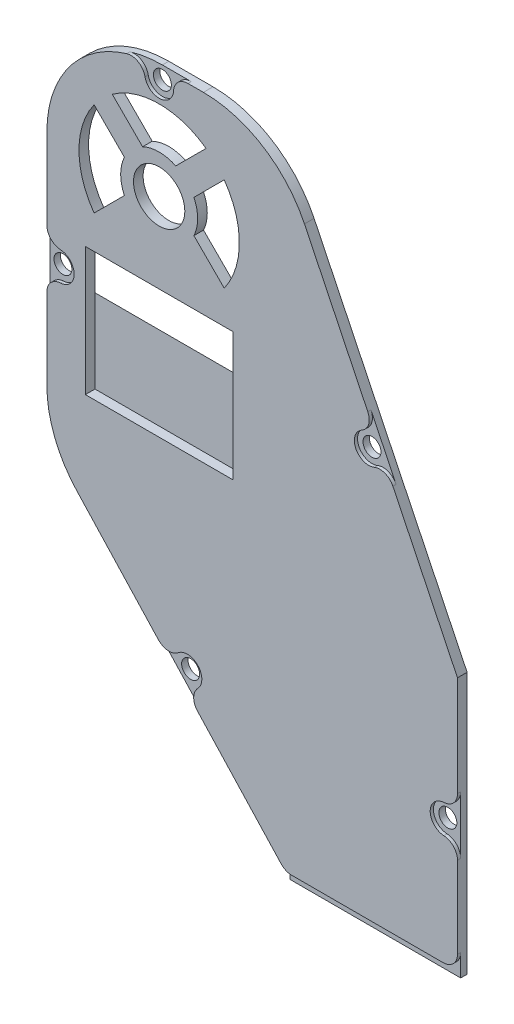
from build123d import *

# Parameters (mm, degrees)
EXTRUDE_1_DEPTH     = 1
EXTRUDE_2_DEPTH     = 0.5
FILLET_1_R          = 2.25
CUT_EXTRUDE_1_REACH = 96.714
SKETCH_3_R          = 1.4
CUT_EXTRUDE_2_REACH = 96.714
SKETCH_4_R          = 4
SKETCH_4_W          = 23
SKETCH_4_H          = 20
EXTRUDE_START       = 1.5
EXTRUDE_3_DEPTH     = 1.5
FILLET_2_R          = 5


with BuildPart() as part:
    # 스케치1 → 보스-돌출1 (new body)
    with BuildSketch(Plane.XY):
        with BuildLine():
            Line((46.5, -82.5), (46.5, -41.72899408))
            Line((46.5, -41.72899408), (22.650184607, 7.615451559))
            ThreePointArc((22.650184607, 7.615451559), (16.194067118, 14.824311152), (6.894077933, 17.5))
            Line((6.894077933, 17.5), (0, 17.5))
            ThreePointArc((0, 17.5), (-12.374368671, 12.374368671), (-17.5, 0))
            Line((-17.5, 0), (-17.5, -34.255734548))
            ThreePointArc((-17.5, -34.255734548), (-16.295213306, -40.636645401), (-12.846740193, -46.138969227))
            Line((-12.846740193, -46.138969227), (19.862213273, -81.5))
            Line((19.862213273, -81.5), (19.862213273, -82.5))
            Line((19.862213273, -82.5), (46.5, -82.5))
        make_face()
    extrude(amount=EXTRUDE_1_DEPTH)

    # 스케치2 → 보스-돌출2 (add)
    with BuildSketch(Plane(origin=(0, 0, 1), x_dir=(-1, 0, 0), z_dir=(0, 0, -1))):
        with BuildLine():
            Line((-46.5, -81.3), (-19.677213273, -81.3))
            Line((-19.677213273, -81.3), (-4.460038224, -64.848999948))
            Line((-4.460038224, -64.848999948), (-5.928237104, -63.490915985))
            ThreePointArc((-5.928237104, -63.490915985), (-6.052116384, -60.311347787), (-2.872548186, -60.187468507))
            Line((-2.872548186, -60.187468507), (-1.404349307, -61.54555247))
            Line((-1.404349307, -61.54555247), (12.846740193, -46.138969227))
            ThreePointArc((12.846740193, -46.138969227), (16.295213306, -40.636645401), (17.5, -34.255734548))
            Line((17.5, -34.255734548), (17.5, -19.377867274))
            Line((17.5, -19.377867274), (15.5, -19.377867274))
            ThreePointArc((15.5, -19.377867274), (13.25, -17.127867274), (15.5, -14.877867274))
            Line((15.5, -14.877867274), (17.5, -14.877867274))
            Line((17.5, -14.877867274), (17.5, 0))
            ThreePointArc((17.5, 0), (13.145816825, 11.551515052), (2.25, 17.354754392))
            Line((2.25, 17.354754392), (2.25, 15.5))
            ThreePointArc((2.25, 15.5), (0, 13.25), (-2.25, 15.5))
            Line((-2.25, 15.5), (-2.25, 17.5))
            Line((-2.25, 17.5), (-6.894077933, 17.5))
            ThreePointArc((-6.894077933, 17.5), (-16.194067118, 14.824311152), (-22.650184607, 7.615451559))
            Line((-22.650184607, 7.615451559), (-33.49631177, -14.824811536))
            Line((-33.49631177, -14.824811536), (-31.695613865, -15.695148857))
            ThreePointArc((-31.695613865, -15.695148857), (-30.648958207, -18.700063487), (-33.653872837, -19.746719145))
            Line((-33.653872837, -19.746719145), (-35.454570743, -18.876381824))
            Line((-35.454570743, -18.876381824), (-46.5, -41.72899408))
            Line((-46.5, -41.72899408), (-46.5, -59.61))
            Line((-46.5, -59.61), (-44.5, -59.61))
            ThreePointArc((-44.5, -59.61), (-42.25, -61.86), (-44.5, -64.11))
            Line((-44.5, -64.11), (-46.5, -64.11))
            Line((-46.5, -64.11), (-46.5, -81.3))
        make_face()
    extrude(amount=-EXTRUDE_2_DEPTH)

    # 필렛1
    # the kernel refuses this fillet: 2.25 mm, written as the material it takes off along each edge
    with BuildSketch(Plane(origin=(-17.5, -14.877867274, 1), x_dir=(0, 1, 0), z_dir=(0, 0, 1)), Plane(origin=(35.454570743, -18.876381824, 1), x_dir=(0.4351686605402659, -0.9003489528419473, 0), z_dir=(0, 0, 1)), Plane(origin=(46.5, -64.11, 1), x_dir=(0, -1, 0), z_dir=(0, 0, 1)), Plane(origin=(1.404349307, -61.54555247, 1), x_dir=(-0.6790419816174302, 0.7340994395864046, 0), z_dir=(0, 0, 1))) as fillet_1_piece_1:
        with BuildLine():
            CenterArc((2.243050189, -2.25), FILLET_1_R, 90, 86.815261463)
            Line((-0.003474906, -2.125), (-0.228127415, -2.1125))
            ThreePointArc((-0.228127415, -2.1125), (-0.225, -2), (-0.225, 0))
            Line((-0.225, 0), (0, 0.225))
            Line((0, 0.225), (2.243050189, 0.225))
            Line((2.243050189, 0.225), (2.243050189, 0))
        make_face()
    extrude(amount=6.107625472, mode=Mode.SUBTRACT)
    with BuildSketch(Plane(origin=(-17.5, -19.377867274, 1), x_dir=(0, -1, 0), z_dir=(0, 0, 1)), Plane(origin=(33.49631177, -14.824811536, 1), x_dir=(-0.4351686605402757, 0.9003489528419424, 0), z_dir=(0, 0, 1)), Plane(origin=(46.5, -59.61, 1), x_dir=(0, 1, 0), z_dir=(0, 0, 1)), Plane(origin=(4.460038224, -64.848999948, 1), x_dir=(0.679041981617429, -0.7340994395864059, 0), z_dir=(0, 0, 1))) as fillet_1_piece_2:
        with BuildLine():
            CenterArc((2.243050189, 2.25), FILLET_1_R, 183.184738537, 86.815261463)
            Line((-0.003474906, 2.125), (-0.228127415, 2.1125))
            ThreePointArc((-0.228127415, 2.1125), (-0.225, 2), (-0.225, 0))
            Line((-0.225, 0), (0, -0.225))
            Line((0, -0.225), (2.243050189, -0.225))
            Line((2.243050189, -0.225), (2.243050189, 0))
        make_face()
    extrude(amount=6.107625472, mode=Mode.SUBTRACT)
    with BuildSketch(Plane(origin=(2.25, 17.5, 1), x_dir=(-0.0016352474835574222, -0.99999866298194, 0), z_dir=(0, 0, 1))) as fillet_1_piece_3:
        with BuildLine():
            CenterArc((2.24632905, 2.246726497), FILLET_1_R, 180.093692821, 86.815261463)
            Line((-0.003667942, 2.24304719), (-0.228667641, 2.242679259))
            Line((-0.228667641, 2.242679259), (-0.224999699, -0.000367931))
            Line((-0.224999699, -0.000367931), (0.000367931, -0.224999699))
            ThreePointArc((0.000367931, -0.224999699), (2.000365257, -0.221729204), (2.11287022, -0.22467265))
            Line((2.11287022, -0.22467265), (2.125002841, 0))
        make_face()
    extrude(amount=6.107625472, mode=Mode.SUBTRACT)
    with BuildSketch(Plane(origin=(-2.25, 17.354754392, 1), x_dir=(-0.9777990320246813, -0.20954487102192756, 0), z_dir=(0, 0, 1))) as fillet_1_piece_4:
        with BuildLine():
            CenterArc((2.688404361, 2.242406315), FILLET_1_R, 179.456997301, 95.251636128)
            Line((0.438505404, 2.263729662), (0.213515509, 2.265861997))
            ThreePointArc((0.213515509, 2.265861997), (0.168649488, 1.860724645), (-0.220004782, 0.047147596))
            Line((-0.220004782, 0.047147596), (-0.018469954, -0.224240631))
            ThreePointArc((-0.018469954, -0.224240631), (1.436551949, -0.284061995), (2.891573851, -0.224240631))
            Line((2.891573851, -0.224240631), (2.873103897, 0))
        make_face()
    extrude(amount=7.682759743, mode=Mode.SUBTRACT)
    with BuildSketch(Plane(origin=(19.677213273, -81.3, 1), x_dir=(-0.6790419816174232, 0.7340994395864112, 0), z_dir=(0, 0, 1))) as fillet_1_piece_5:
        with BuildLine():
            CenterArc((FILLET_1_R * 0.437213272583, -FILLET_1_R), FILLET_1_R, 90, 47.231174608)
            Line((-FILLET_1_R * 0.296886167004, -FILLET_1_R * 0.320958018383), (0, 0))
            Line((0, 0), (FILLET_1_R * 0.437213272583, 0))
        make_face()
    extrude(amount=2.959324658, mode=Mode.SUBTRACT)
    with BuildSketch(Plane(origin=(46.5, -81.3, 1), x_dir=(0, 1, 0), z_dir=(0, 0, 1))) as fillet_1_piece_6:
        with BuildLine():
            CenterArc((FILLET_1_R, FILLET_1_R), FILLET_1_R, 180, 90)
            Line((0, FILLET_1_R), (0, 0))
            Line((0, 0), (FILLET_1_R, 0))
        make_face()
    extrude(amount=6.125, mode=Mode.SUBTRACT)

    # 스케치3 → 컷-돌출1 (cut, up to next)
    with BuildSketch(Plane(origin=(0, 0, 0), x_dir=(-1, 0, 0), z_dir=(0, 0, -1)), mode=Mode.PRIVATE) as cut_extrude_1_sk1:
        with Locations((0, 15.5)):
            Circle(SKETCH_3_R)
    cut_extrude_1_tool1 = extrude(cut_extrude_1_sk1.sketch, amount=-CUT_EXTRUDE_1_REACH, mode=Mode.PRIVATE) & part.part
    # 스케치3 → 컷-돌출1 (cut, up to next)
    with BuildSketch(Plane(origin=(0, 0, 0), x_dir=(-1, 0, 0), z_dir=(0, 0, -1)), mode=Mode.PRIVATE) as cut_extrude_1_sk2:
        with Locations((15.5, -17.127867274)):
            Circle(SKETCH_3_R)
    cut_extrude_1_tool2 = extrude(cut_extrude_1_sk2.sketch, amount=-CUT_EXTRUDE_1_REACH, mode=Mode.PRIVATE) & part.part
    # 스케치3 → 컷-돌출1 (cut, up to next)
    with BuildSketch(Plane(origin=(0, 0, 0), x_dir=(-1, 0, 0), z_dir=(0, 0, -1)), mode=Mode.PRIVATE) as cut_extrude_1_sk3:
        with Locations((-32.674743351, -17.720934001)):
            Circle(SKETCH_3_R)
    cut_extrude_1_tool3 = extrude(cut_extrude_1_sk3.sketch, amount=-CUT_EXTRUDE_1_REACH, mode=Mode.PRIVATE) & part.part
    # 스케치3 → 컷-돌출1 (cut, up to next)
    with BuildSketch(Plane(origin=(0, 0, 0), x_dir=(-1, 0, 0), z_dir=(0, 0, -1)), mode=Mode.PRIVATE) as cut_extrude_1_sk4:
        with Locations((-44.5, -61.86)):
            Circle(SKETCH_3_R)
    cut_extrude_1_tool4 = extrude(cut_extrude_1_sk4.sketch, amount=-CUT_EXTRUDE_1_REACH, mode=Mode.PRIVATE) & part.part
    # 스케치3 → 컷-돌출1 (cut, up to next)
    with BuildSketch(Plane(origin=(0, 0, 0), x_dir=(-1, 0, 0), z_dir=(0, 0, -1)), mode=Mode.PRIVATE) as cut_extrude_1_sk5:
        with Locations((-4.400392645, -61.839192246)):
            Circle(SKETCH_3_R)
    cut_extrude_1_tool5 = extrude(cut_extrude_1_sk5.sketch, amount=-CUT_EXTRUDE_1_REACH, mode=Mode.PRIVATE) & part.part
    add(cut_extrude_1_tool1.solids().sort_by_distance((0, 15.5, 0))[0], mode=Mode.SUBTRACT)
    add(cut_extrude_1_tool2.solids().sort_by_distance((-15.5, -17.127867, 0))[0], mode=Mode.SUBTRACT)
    add(cut_extrude_1_tool3.solids().sort_by_distance((32.674743, -17.720934, 0))[0], mode=Mode.SUBTRACT)
    add(cut_extrude_1_tool4.solids().sort_by_distance((44.5, -61.86, 0))[0], mode=Mode.SUBTRACT)
    add(cut_extrude_1_tool5.solids().sort_by_distance((4.400393, -61.839192, 0))[0], mode=Mode.SUBTRACT)

    # 스케치4 → 컷-돌출2 (cut, up to next)
    with BuildSketch(Plane.XY.offset(1.5), mode=Mode.PRIVATE) as cut_extrude_2_sk1:
        Circle(SKETCH_4_R)
    cut_extrude_2_tool1 = extrude(cut_extrude_2_sk1.sketch, amount=-CUT_EXTRUDE_2_REACH, mode=Mode.PRIVATE) & part.part
    # 스케치4 → 컷-돌출2 (cut, up to next)
    with BuildSketch(Plane.XY.offset(1.5), mode=Mode.PRIVATE) as cut_extrude_2_sk2:
        with Locations((0, -22.5)):
            Rectangle(SKETCH_4_W, SKETCH_4_H)
    cut_extrude_2_tool2 = extrude(cut_extrude_2_sk2.sketch, amount=-CUT_EXTRUDE_2_REACH, mode=Mode.PRIVATE) & part.part
    # 스케치4 → 컷-돌출2 (cut, up to next)
    with BuildSketch(Plane.XY.offset(1.5), mode=Mode.PRIVATE) as cut_extrude_2_sk3:
        with BuildLine():
            Line((-5.414213562, -2.585786438), (-10.139177746, -7.310750621))
            ThreePointArc((-10.139177746, -7.310750621), (-12.5, 0), (-10.139177746, 7.310750621))
            Line((-10.139177746, 7.310750621), (-5.414213562, 2.585786438))
            ThreePointArc((-5.414213562, 2.585786438), (-6, 0), (-5.414213562, -2.585786438))
        make_face()
    cut_extrude_2_tool3 = extrude(cut_extrude_2_sk3.sketch, amount=-CUT_EXTRUDE_2_REACH, mode=Mode.PRIVATE) & part.part
    # 스케치4 → 컷-돌출2 (cut, up to next)
    with BuildSketch(Plane.XY.offset(1.5), mode=Mode.PRIVATE) as cut_extrude_2_sk4:
        with BuildLine():
            Line((5.414213562, -2.585786438), (10.139177746, -7.310750621))
            ThreePointArc((10.139177746, -7.310750621), (12.5, 0), (10.139177746, 7.310750621))
            Line((10.139177746, 7.310750621), (5.414213562, 2.585786438))
            ThreePointArc((5.414213562, 2.585786438), (6, 0), (5.414213562, -2.585786438))
        make_face()
    cut_extrude_2_tool4 = extrude(cut_extrude_2_sk4.sketch, amount=-CUT_EXTRUDE_2_REACH, mode=Mode.PRIVATE) & part.part
    # 스케치4 → 컷-돌출2 (cut, up to next)
    with BuildSketch(Plane.XY.offset(1.5), mode=Mode.PRIVATE) as cut_extrude_2_sk5:
        with BuildLine():
            Line((2.585786438, 5.414213562), (7.310750621, 10.139177746))
            ThreePointArc((7.310750621, 10.139177746), (0, 12.5), (-7.310750621, 10.139177746))
            Line((-7.310750621, 10.139177746), (-2.585786438, 5.414213562))
            ThreePointArc((-2.585786438, 5.414213562), (0, 6), (2.585786438, 5.414213562))
        make_face()
    cut_extrude_2_tool5 = extrude(cut_extrude_2_sk5.sketch, amount=-CUT_EXTRUDE_2_REACH, mode=Mode.PRIVATE) & part.part
    add(cut_extrude_2_tool1.solids().sort_by_distance((0, 0, 1.5))[0], mode=Mode.SUBTRACT)
    add(cut_extrude_2_tool2.solids().sort_by_distance((0, -22.5, 1.5))[0], mode=Mode.SUBTRACT)
    add(cut_extrude_2_tool3.solids().sort_by_distance((-9.239512, 0, 1.5))[0], mode=Mode.SUBTRACT)
    add(cut_extrude_2_tool4.solids().sort_by_distance((9.239512, 0, 1.5))[0], mode=Mode.SUBTRACT)
    add(cut_extrude_2_tool5.solids().sort_by_distance((0, 9.239512, 1.5))[0], mode=Mode.SUBTRACT)

    # 스케치6 → 보스-돌출3 (add)
    with BuildSketch(Plane(origin=(0, 0, 0), x_dir=(-1, 0, 0), z_dir=(0, 0, -1)).offset(EXTRUDE_START)):
        with BuildLine():
            Line((17.5, -19.5), (-17.5, -19.5))
            Line((-17.5, -19.5), (-17.5, -38.5))
            Line((-17.5, -38.5), (16.977520749, -38.5))
            ThreePointArc((16.977520749, -38.5), (17.368889042, -36.393886425), (17.5, -34.255734548))
            Line((17.5, -34.255734548), (17.5, -19.5))
        make_face()
    extrude(amount=-EXTRUDE_3_DEPTH)

    # 필렛2
    # the kernel refuses this fillet: 5 mm, written as the material it takes off along each edge
    with BuildSketch(Plane(origin=(-26.426785536, -19.5, -1.5), x_dir=(0, 0, 1), z_dir=(1, 0, 0))) as fillet_2_piece_1:
        with BuildLine():
            CenterArc((5, 3.570714214), FILLET_2_R, 180, 45.572995999)
            Line((0, 3.570714214), (-0.1, 3.570714214))
            Line((-0.1, 3.570714214), (-0.1, 0))
            Line((-0.1, 0), (0, -0.1))
            ThreePointArc((0, -0.1), (0.75, -0.1), (1.43, -0.071414284))
            Line((1.43, -0.071414284), (1.5, 0))
        make_face()
    extrude(amount=52.853571071, mode=Mode.SUBTRACT)
    with BuildSketch(Plane(origin=(17.5, -10.573214464, -1.5), x_dir=(0, 0, 1), z_dir=(0, -1, 0))) as fillet_2_piece_2:
        with BuildLine():
            CenterArc((5, 3.570714214), FILLET_2_R, 180, 45.572995999)
            Line((0, 3.570714214), (-0.1, 3.570714214))
            Line((-0.1, 3.570714214), (-0.1, 0))
            Line((-0.1, 0), (0, -0.1))
            ThreePointArc((0, -0.1), (0.75, -0.1), (1.43, -0.071414284))
            Line((1.43, -0.071414284), (1.5, 0))
        make_face()
    extrude(amount=36.853571071, mode=Mode.SUBTRACT)
    with BuildSketch(Plane(origin=(26.426785536, -38.5, -1.5), x_dir=(0, 0, 1), z_dir=(-1, 0, 0))) as fillet_2_piece_3:
        with BuildLine():
            CenterArc((5, 3.570714214), FILLET_2_R, 180, 45.572995999)
            Line((0, 3.570714214), (-0.1, 3.570714214))
            Line((-0.1, 3.570714214), (-0.1, 0))
            Line((-0.1, 0), (0, -0.1))
            ThreePointArc((0, -0.1), (0.75, -0.1), (1.43, -0.071414284))
            Line((1.43, -0.071414284), (1.5, 0))
        make_face()
    extrude(amount=52.33109182, mode=Mode.SUBTRACT)


solid = part.part
